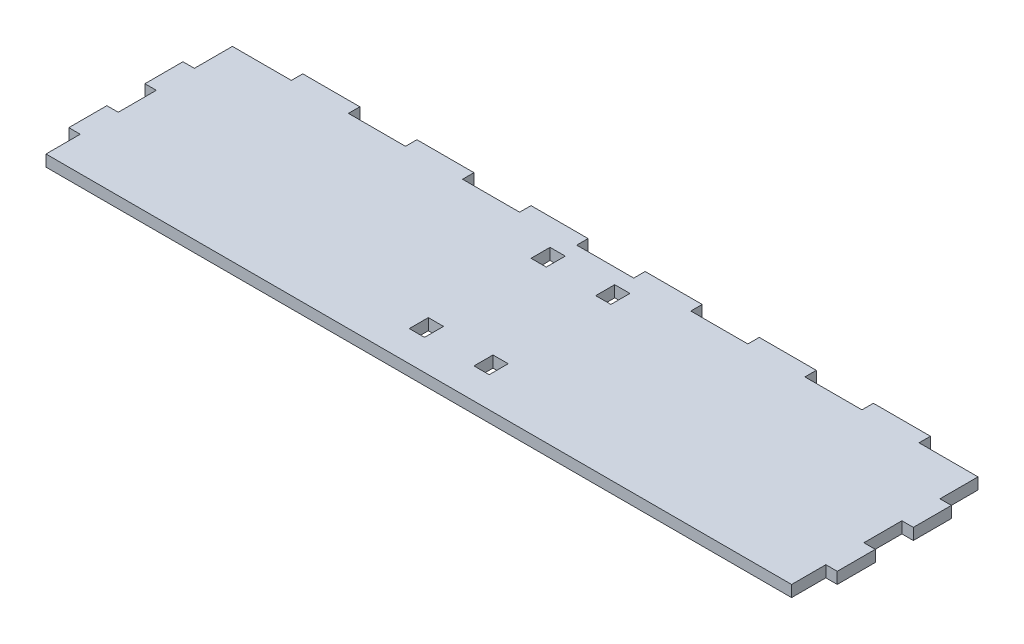
from build123d import *

# Parameters (mm, degrees)
BOSS_EXTRUDE1_DEPTH = 3
SKETCH2_W           = 4
SKETCH2_H           = 5
CUT_EXTRUDE1_DEPTH  = 10


with BuildPart() as part:
    # Sketch1 → Boss-Extrude1 (new body)
    with BuildSketch(Plane(origin=(0, 0, 0), x_dir=(1, 0, 0), z_dir=(0, 1, 0))):
        Polygon((15, 0), (-0.5, 0), (-0.5, -10), (-3.5, -10), (-3.5, -20), (-0.5, -20), (-0.5, -30), (-3.5, -30), (-3.5, -40), (-0.5, -40), (-0.5, -49), (195.5, -49), (195.5, -40), (198.5, -40), (198.5, -30), (195.5, -30), (195.5, -20), (198.5, -20), (198.5, -10), (195.5, -10), (195.5, 0), (180, 0), (180, 3), (165, 3), (165, 0), (150, 0), (150, 3), (135, 3), (135, 0), (120, 0), (120, 3), (105, 3), (105, 0), (90, 0), (90, 3), (75, 3), (75, 0), (60, 0), (60, 3), (45, 3), (45, 0), (30, 0), (30, 3), (15, 3), align=None)
    extrude(amount=BOSS_EXTRUDE1_DEPTH)

    # Sketch2 → Cut-Extrude1 (cut)
    with BuildSketch(Plane(origin=(0, 3, 0), x_dir=(1, 0, 0), z_dir=(0, 1, 0))):
        with Locations((106, -38.5)):
            Rectangle(SKETCH2_W, SKETCH2_H)
        with Locations((89, -38.5)):
            Rectangle(SKETCH2_W, SKETCH2_H)
        with Locations((106, -6.5)):
            Rectangle(SKETCH2_W, SKETCH2_H)
        with Locations((89, -6.5)):
            Rectangle(SKETCH2_W, SKETCH2_H)
    extrude(amount=-CUT_EXTRUDE1_DEPTH, mode=Mode.SUBTRACT)


solid = part.part
